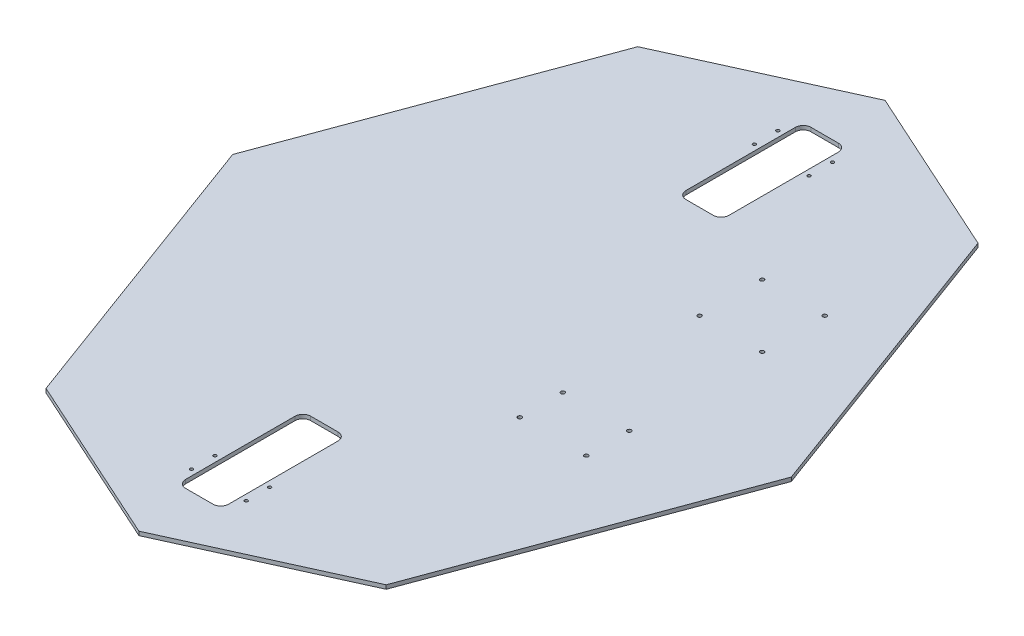
from build123d import *

# Parameters (mm, degrees)
BOSS_EXTRUDE1_DEPTH  = 3.175
SKETCH2_W            = 69.85
SKETCH2_H            = 203.2
SKETCH2_R            = 2.54
CUT_EXTRUDE1_DEPTH   = 758.18700012
FILLET1_R            = 12.7
CUT_EXTRUDE3_REACH   = 759.207
SKETCH4_R            = 3.175
FILLET1_OF_MIRROR1_R = 12.7


with BuildPart() as part:
    # Sketch1 → Boss-Extrude1 (new, symmetric)
    with BuildSketch(Plane(origin=(0, 0, 0), x_dir=(1, 0, 0), z_dir=(0, 1, 0))):
        Polygon((-276.369998818, 480.707209327), (-453.815592601, 0), (-276.369998818, -480.707209327), (0, -606.11342209), (276.369998818, -480.707209327), (453.815592601, 0), (276.369998818, 480.707209327), (0, 606.11342209), align=None)
    extrude(amount=BOSS_EXTRUDE1_DEPTH, both=True)

    # Sketch2 → Cut-Extrude1 (cut, symmetric)
    with BuildSketch(Plane(origin=(0, 0, 0), x_dir=(1, 0, 0), z_dir=(0, 1, 0))):
        with Locations((0, 406.4)):
            Rectangle(SKETCH2_W, SKETCH2_H)
        with Locations((-44.45, 476.25)):
            Circle(SKETCH2_R)
        with Locations((-44.45, 438.15)):
            Circle(SKETCH2_R)
        with Locations((44.45, 438.15)):
            Circle(SKETCH2_R)
        with Locations((44.45, 476.25)):
            Circle(SKETCH2_R)
    cut_extrude1 = extrude(amount=CUT_EXTRUDE1_DEPTH, both=True, mode=Mode.SUBTRACT)

    # Fillet1
    fillet1_edges = [part.edges().sort_by_distance(p)[0] for p in [
        (-34.925, 0, -508),
        (34.925, 0, -508),
        (34.925, 0, -304.8),
        (-34.925, 0, -304.8),
    ]]
    fillet(fillet1_edges, radius=FILLET1_R)

    # Sketch4 → Cut-Extrude3 (cut, up to next)
    with BuildSketch(Plane(origin=(0, 3.175, 0), x_dir=(1, 0, 0), z_dir=(0, 1, 0)), mode=Mode.PRIVATE) as cut_extrude3_sk1:
        with Locations((257.175, -66.675)):
            Circle(SKETCH4_R)
    cut_extrude3_tool1 = extrude(cut_extrude3_sk1.sketch, amount=-CUT_EXTRUDE3_REACH, mode=Mode.PRIVATE) & part.part
    # Sketch4 → Cut-Extrude3 (cut, up to next)
    with BuildSketch(Plane(origin=(0, 3.175, 0), x_dir=(1, 0, 0), z_dir=(0, 1, 0)), mode=Mode.PRIVATE) as cut_extrude3_sk2:
        with Locations((149.225, -66.675)):
            Circle(SKETCH4_R)
    cut_extrude3_tool2 = extrude(cut_extrude3_sk2.sketch, amount=-CUT_EXTRUDE3_REACH, mode=Mode.PRIVATE) & part.part
    # Sketch4 → Cut-Extrude3 (cut, up to next)
    with BuildSketch(Plane(origin=(0, 3.175, 0), x_dir=(1, 0, 0), z_dir=(0, 1, 0)), mode=Mode.PRIVATE) as cut_extrude3_sk3:
        with Locations((149.225, -136.525)):
            Circle(SKETCH4_R)
    cut_extrude3_tool3 = extrude(cut_extrude3_sk3.sketch, amount=-CUT_EXTRUDE3_REACH, mode=Mode.PRIVATE) & part.part
    # Sketch4 → Cut-Extrude3 (cut, up to next)
    with BuildSketch(Plane(origin=(0, 3.175, 0), x_dir=(1, 0, 0), z_dir=(0, 1, 0)), mode=Mode.PRIVATE) as cut_extrude3_sk4:
        with Locations((257.175, -136.525)):
            Circle(SKETCH4_R)
    cut_extrude3_tool4 = extrude(cut_extrude3_sk4.sketch, amount=-CUT_EXTRUDE3_REACH, mode=Mode.PRIVATE) & part.part
    # Sketch4 → Cut-Extrude3 (cut, up to next)
    with BuildSketch(Plane(origin=(0, 3.175, 0), x_dir=(1, 0, 0), z_dir=(0, 1, 0)), mode=Mode.PRIVATE) as cut_extrude3_sk5:
        with Locations((152.4, 254)):
            Circle(SKETCH4_R)
    cut_extrude3_tool5 = extrude(cut_extrude3_sk5.sketch, amount=-CUT_EXTRUDE3_REACH, mode=Mode.PRIVATE) & part.part
    # Sketch4 → Cut-Extrude3 (cut, up to next)
    with BuildSketch(Plane(origin=(0, 3.175, 0), x_dir=(1, 0, 0), z_dir=(0, 1, 0)), mode=Mode.PRIVATE) as cut_extrude3_sk6:
        with Locations((254, 254)):
            Circle(SKETCH4_R)
    cut_extrude3_tool6 = extrude(cut_extrude3_sk6.sketch, amount=-CUT_EXTRUDE3_REACH, mode=Mode.PRIVATE) & part.part
    # Sketch4 → Cut-Extrude3 (cut, up to next)
    with BuildSketch(Plane(origin=(0, 3.175, 0), x_dir=(1, 0, 0), z_dir=(0, 1, 0)), mode=Mode.PRIVATE) as cut_extrude3_sk7:
        with Locations((254, 152.4)):
            Circle(SKETCH4_R)
    cut_extrude3_tool7 = extrude(cut_extrude3_sk7.sketch, amount=-CUT_EXTRUDE3_REACH, mode=Mode.PRIVATE) & part.part
    # Sketch4 → Cut-Extrude3 (cut, up to next)
    with BuildSketch(Plane(origin=(0, 3.175, 0), x_dir=(1, 0, 0), z_dir=(0, 1, 0)), mode=Mode.PRIVATE) as cut_extrude3_sk8:
        with Locations((152.4, 152.4)):
            Circle(SKETCH4_R)
    cut_extrude3_tool8 = extrude(cut_extrude3_sk8.sketch, amount=-CUT_EXTRUDE3_REACH, mode=Mode.PRIVATE) & part.part
    add(cut_extrude3_tool1.solids().sort_by_distance((257.175, 3.175, 66.675))[0], mode=Mode.SUBTRACT)
    add(cut_extrude3_tool2.solids().sort_by_distance((149.225, 3.175, 66.675))[0], mode=Mode.SUBTRACT)
    add(cut_extrude3_tool3.solids().sort_by_distance((149.225, 3.175, 136.525))[0], mode=Mode.SUBTRACT)
    add(cut_extrude3_tool4.solids().sort_by_distance((257.175, 3.175, 136.525))[0], mode=Mode.SUBTRACT)
    add(cut_extrude3_tool5.solids().sort_by_distance((152.4, 3.175, -254))[0], mode=Mode.SUBTRACT)
    add(cut_extrude3_tool6.solids().sort_by_distance((254, 3.175, -254))[0], mode=Mode.SUBTRACT)
    add(cut_extrude3_tool7.solids().sort_by_distance((254, 3.175, -152.4))[0], mode=Mode.SUBTRACT)
    add(cut_extrude3_tool8.solids().sort_by_distance((152.4, 3.175, -152.4))[0], mode=Mode.SUBTRACT)

    # Mirror1: Cut-Extrude1 across plane
    add(cut_extrude1.mirror(Plane.XY), mode=Mode.SUBTRACT)

    # Fillet1 of Mirror1
    fillet1_of_mirror1_edges = [part.edges().sort_by_distance(p)[0] for p in [
        (-34.925, 0, 508),
        (34.925, 0, 508),
        (34.925, 0, 304.8),
        (-34.925, 0, 304.8),
    ]]
    fillet(fillet1_of_mirror1_edges, radius=FILLET1_OF_MIRROR1_R)


solid = part.part
